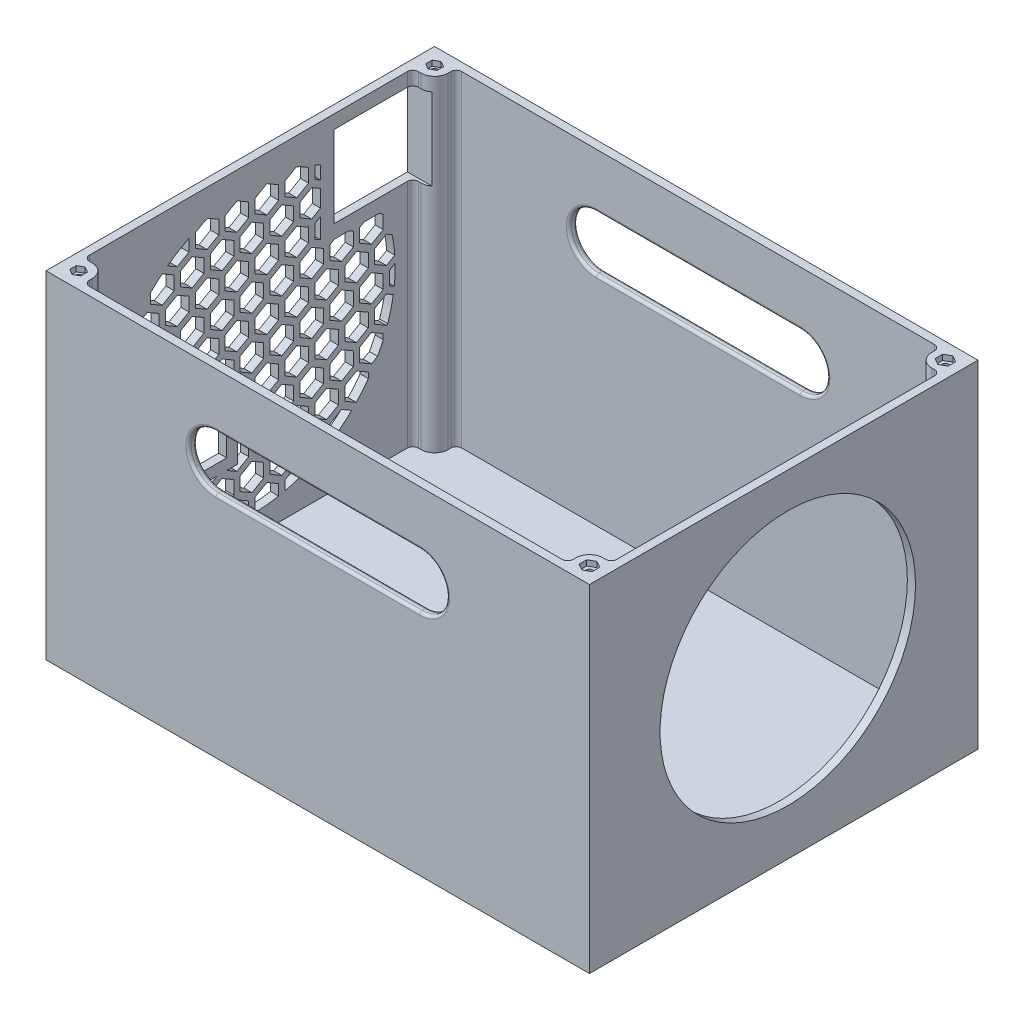
from build123d import *

# Parameters (mm, degrees)
SKETCH1_W            = 254
SKETCH1_H            = 152.4
BOSS_EXTRUDE1_DEPTH  = 3.81
SKETCH2_R            = 1.5875
BOSS_EXTRUDE2_DEPTH  = 152.4
SKETCH4_W            = 3.81
SKETCH4_H            = 152.4
BOSS_EXTRUDE3_DEPTH  = 177.8
SKETCH3_R            = 1.7145
CUT_EXTRUDE1_DEPTH   = 348.453525094
SKETCH5_W            = 3.81
SKETCH5_H            = 152.4
BOSS_EXTRUDE4_DEPTH  = 248.92
SKETCH6_R            = 1.5875
BOSS_EXTRUDE5_DEPTH  = 152.4
SKETCH8_R            = 59.69
CUT_EXTRUDE3_DEPTH   = 5.08
CUT_EXTRUDE4_DEPTH   = 5.08
SKETCH10_W           = 57.658
SKETCH10_H           = 36.720028342
SKETCH10_W_2         = 47.498
SKETCH10_H_2         = 27.178
BOSS_EXTRUDE6_DEPTH  = 3.81
SKETCH11_W           = 47.498
SKETCH11_H           = 26.973066783
CUT_EXTRUDE5_DEPTH   = 7.62
FILLET1_R            = 2.54
SKETCH12_W           = 47.498
SKETCH12_H           = 0.254
CUT_EXTRUDE6_DEPTH   = 7.62
SKETCH13_W           = 19.05
SKETCH13_H           = 12.7
BOSS_EXTRUDE9_DEPTH  = 3.81
SKETCH15_W           = 38.1
SKETCH15_H           = 38.1
CUT_EXTRUDE8_DEPTH   = 12.7
SKETCH16_W           = 50.8
SKETCH16_H           = 50.8
SKETCH16_W_2         = 38.1
SKETCH16_H_2         = 38.1
BOSS_EXTRUDE10_DEPTH = 3.81
CUT_EXTRUDE9_DEPTH   = 2.54
SKETCH19_W           = 181.61
SKETCH19_H           = 5.08
BOSS_EXTRUDE12_DEPTH = 254
CUT_EXTRUDE10_DEPTH  = 348.453525094
FILLET3_R            = 1.27


with BuildPart() as part:
    # Sketch1 → Boss-Extrude1 (new body)
    with BuildSketch(Plane.XY):
        with Locations((127, 76.2)):
            Rectangle(SKETCH1_W, SKETCH1_H)
    extrude(amount=BOSS_EXTRUDE1_DEPTH)

    # Sketch2 → Boss-Extrude2 (add, through all)
    # profile 1 of 2: a face of its own
    with BuildSketch(Plane(origin=(0, 152.4, 0), x_dir=(1, 0, 0), z_dir=(0, 1, 0))):
        with BuildLine():
            Line((13.97, -7.62), (13.97, 0))
            Line((13.97, 0), (2.54, 0))
            Line((2.54, 0), (0, 0))
            Line((0, 0), (0, -13.97))
            Line((0, -13.97), (2.54, -13.97))
            Line((2.54, -13.97), (7.62, -13.97))
            ThreePointArc((7.62, -13.97), (12.110128061, -12.110128061), (13.97, -7.62))
        make_face()
        with Locations(Location((7.62, -7.62, 0), (0, 0, 270))):
            Circle(SKETCH2_R, mode=Mode.SUBTRACT)
    # profile 2 of 2: a face of its own
    with BuildSketch(Plane(origin=(0, 152.4, 0), x_dir=(1, 0, 0), z_dir=(0, 1, 0))):
        with BuildLine():
            Line((254, -13.97), (251.46, -13.97))
            Line((251.46, -13.97), (246.38, -13.97))
            ThreePointArc((246.38, -13.97), (241.889871939, -12.110128061), (240.03, -7.62))
            Line((240.03, -7.62), (240.03, 0))
            Line((240.03, 0), (254, 0))
            Line((254, 0), (254, -13.97))
        make_face()
        with Locations(Location((246.38, -7.62, 0), (0, 0, 270))):
            Circle(SKETCH2_R, mode=Mode.SUBTRACT)
    extrude(amount=-BOSS_EXTRUDE2_DEPTH)

    # Sketch4 → Boss-Extrude3 (add)
    with BuildSketch(Plane.XY.offset(3.81)):
        with Locations((1.905, 76.2)):
            Rectangle(SKETCH4_W, SKETCH4_H)
        with Locations((252.095, 76.2)):
            Rectangle(SKETCH4_W, SKETCH4_H)
    extrude(amount=BOSS_EXTRUDE3_DEPTH)

    # Sketch3 → Cut-Extrude1 (cut, through all)
    with BuildSketch(Plane(origin=(0, 152.4, 0), x_dir=(1, 0, 0), z_dir=(0, 1, 0))):
        with Locations(Location((7.62, -7.62, 0), (0, 0, 270))):
            Circle(SKETCH3_R)
        with Locations(Location((246.38, -7.62, 0), (0, 0, 270))):
            Circle(SKETCH3_R)
    extrude(amount=-CUT_EXTRUDE1_DEPTH, mode=Mode.SUBTRACT)

    # Sketch5 → Boss-Extrude4 (add)
    with BuildSketch(Plane(origin=(3.81, 0, 0), x_dir=(0, 0, -1), z_dir=(1, 0, 0))):
        with Locations((-179.705, 76.2)):
            Rectangle(SKETCH5_W, SKETCH5_H)
    extrude(amount=BOSS_EXTRUDE4_DEPTH)

    # Sketch6 → Boss-Extrude5 (add, through all)
    # profile 1 of 2: a face of its own
    with BuildSketch(Plane(origin=(0, 152.4, 0), x_dir=(1, 0, 0), z_dir=(0, 1, 0))):
        with BuildLine():
            Line((7.62, -167.64), (0, -167.64))
            Line((0, -167.64), (0, -181.61))
            Line((0, -181.61), (13.97, -181.61))
            Line((13.97, -181.61), (13.97, -173.99))
            ThreePointArc((13.97, -173.99), (12.110128061, -169.499871939), (7.62, -167.64))
        make_face()
        with Locations(Location((7.62, -173.99, 0), (0, 0, 270))):
            Circle(SKETCH6_R, mode=Mode.SUBTRACT)
    # profile 2 of 2: a face of its own
    with BuildSketch(Plane(origin=(0, 152.4, 0), x_dir=(1, 0, 0), z_dir=(0, 1, 0))):
        with BuildLine():
            Line((240.03, -181.61), (240.03, -173.99))
            ThreePointArc((240.03, -173.99), (241.889871939, -169.499871939), (246.38, -167.64))
            Line((246.38, -167.64), (254, -167.64))
            Line((254, -167.64), (254, -181.61))
            Line((254, -181.61), (240.03, -181.61))
        make_face()
        with Locations(Location((246.38, -173.99, 0), (0, 0, 270))):
            Circle(SKETCH6_R, mode=Mode.SUBTRACT)
    extrude(amount=-BOSS_EXTRUDE5_DEPTH)

    # Sketch8 → Cut-Extrude3 (cut)
    with BuildSketch(Plane(origin=(254, 0, 0), x_dir=(0, 0, -1), z_dir=(1, 0, 0))):
        with Locations((-88.9, 76.2)):
            Circle(SKETCH8_R)
    extrude(amount=-CUT_EXTRUDE3_DEPTH, mode=Mode.SUBTRACT)

    # Sketch9 → Cut-Extrude4 (cut)
    with BuildSketch(Plane.ZY):
        Polygon((55.739425868, 124.586865773), (55.739425868, 118.236865773), (61.238687182, 115.061865773), (66.737948496, 118.236865773), (66.737948496, 124.586865773), (61.238687182, 127.761865773), align=None)
        with BuildLine():
            Line((49.436181633, 129.941628789), (54.253687182, 127.160240664))
            Line((54.253687182, 127.160240664), (59.752948496, 130.335240664))
            Line((59.752948496, 130.335240664), (59.752948496, 136.166699206))
            ThreePointArc((59.752948496, 136.166699206), (54.453654163, 133.287694677), (49.436181633, 129.941628789))
        make_face()
        with BuildLine():
            ThreePointArc((68.525810536, 139.685809664), (67.809311572, 139.451391183), (67.095508855, 139.208886603))
            Line((67.095508855, 139.208886603), (62.724425868, 136.685240664))
            Line((62.724425868, 136.685240664), (62.724425868, 130.335240664))
            Line((62.724425868, 130.335240664), (68.223687182, 127.160240664))
            Line((68.223687182, 127.160240664), (73.722948496, 130.335240664))
            Line((73.722948496, 130.335240664), (73.722948496, 136.685240664))
            Line((73.722948496, 136.685240664), (68.525810536, 139.685809664))
        make_face()
        Polygon((76.694425868, 136.685240664), (76.694425868, 130.335240664), (82.193687182, 127.160240664), (87.692948496, 130.335240664), (87.692948496, 136.685240664), (82.193687182, 139.860240664), align=None)
        Polygon((90.664425868, 136.685240664), (90.664425868, 130.335240664), (96.163687182, 127.160240664), (101.662948496, 130.335240664), (101.662948496, 136.685240664), (96.163687182, 139.860240664), align=None)
        with BuildLine():
            ThreePointArc((112.180132907, 138.678724674), (110.91017808, 139.137331417), (109.631196964, 139.570127801))
            Line((109.631196964, 139.570127801), (104.634425868, 136.685240664))
            Line((104.634425868, 136.685240664), (104.634425868, 130.335240664))
            Line((104.634425868, 130.335240664), (110.133687182, 127.160240664))
            Line((110.133687182, 127.160240664), (115.632948496, 130.335240664))
            Line((115.632948496, 130.335240664), (115.632948496, 136.685240664))
            Line((115.632948496, 136.685240664), (112.180132907, 138.678724674))
        make_face()
        with BuildLine():
            ThreePointArc((128.608497845, 129.761094312), (123.741602114, 133.047325242), (118.604425868, 135.892568288))
            Line((118.604425868, 135.892568288), (118.604425868, 130.335240664))
            Line((118.604425868, 130.335240664), (124.103687182, 127.160240664))
            Line((124.103687182, 127.160240664), (128.608497845, 129.761094312))
        make_face()
        with BuildLine():
            ThreePointArc((136.587948496, 122.798446253), (134.041922324, 125.268956316), (131.36809631, 127.600548838))
            Line((131.36809631, 127.600548838), (131.088687182, 127.761865773))
            Line((131.088687182, 127.761865773), (125.589425868, 124.586865773))
            Line((125.589425868, 124.586865773), (125.589425868, 118.236865773))
            Line((125.589425868, 118.236865773), (131.088687182, 115.061865773))
            Line((131.088687182, 115.061865773), (136.587948496, 118.236865773))
            Line((136.587948496, 118.236865773), (136.587948496, 122.798446253))
        make_face()
        Polygon((111.619425868, 124.586865773), (111.619425868, 118.236865773), (117.118687182, 115.061865773), (122.617948496, 118.236865773), (122.617948496, 124.586865773), (117.118687182, 127.761865773), align=None)
        Polygon((97.649425868, 124.586865773), (97.649425868, 118.236865773), (103.148687182, 115.061865773), (108.647948496, 118.236865773), (108.647948496, 124.586865773), (103.148687182, 127.761865773), align=None)
        Polygon((83.679425868, 124.586865773), (83.679425868, 118.236865773), (89.178687182, 115.061865773), (94.677948496, 118.236865773), (94.677948496, 124.586865773), (89.178687182, 127.761865773), align=None)
        Polygon((69.709425868, 124.586865773), (69.709425868, 118.236865773), (75.208687182, 115.061865773), (80.707948496, 118.236865773), (80.707948496, 124.586865773), (75.208687182, 127.761865773), align=None)
        with BuildLine():
            Line((47.268687182, 127.761865773), (45.23494911, 126.587686549))
            ThreePointArc((45.23494911, 126.587686549), (43.473548818, 125.005667273), (41.769425868, 123.362109866))
            Line((41.769425868, 123.362109866), (41.769425868, 118.236865773))
            Line((41.769425868, 118.236865773), (47.268687182, 115.061865773))
            Line((47.268687182, 115.061865773), (52.767948496, 118.236865773))
            Line((52.767948496, 118.236865773), (52.767948496, 124.586865773))
            Line((52.767948496, 124.586865773), (47.268687182, 127.761865773))
        make_face()
        Polygon((34.784425868, 112.488490882), (34.784425868, 106.138490882), (40.283687182, 102.963490882), (45.782948496, 106.138490882), (45.782948496, 112.488490882), (40.283687182, 115.663490882), align=None)
        with BuildLine():
            Line((31.812948496, 106.138490882), (31.812948496, 110.647411741))
            ThreePointArc((31.812948496, 110.647411741), (29.999317758, 107.445243742), (28.365124652, 104.147888857))
            Line((28.365124652, 104.147888857), (31.812948496, 106.138490882))
        make_face()
        Polygon((48.754425868, 112.488490882), (48.754425868, 106.138490882), (54.253687182, 102.963490882), (59.752948496, 106.138490882), (59.752948496, 112.488490882), (54.253687182, 115.663490882), align=None)
        Polygon((62.724425868, 112.488490882), (62.724425868, 106.138490882), (68.223687182, 102.963490882), (73.722948496, 106.138490882), (73.722948496, 112.488490882), (68.223687182, 115.663490882), align=None)
        Polygon((76.694425868, 112.488490882), (76.694425868, 106.138490882), (82.193687182, 102.963490882), (87.692948496, 106.138490882), (87.692948496, 112.488490882), (82.193687182, 115.663490882), align=None)
        Polygon((90.664425868, 112.488490882), (90.664425868, 106.138490882), (96.163687182, 102.963490882), (101.662948496, 106.138490882), (101.662948496, 112.488490882), (96.163687182, 115.663490882), align=None)
        Polygon((104.634425868, 112.488490882), (104.634425868, 106.138490882), (110.133687182, 102.963490882), (115.632948496, 106.138490882), (115.632948496, 112.488490882), (110.133687182, 115.663490882), align=None)
        Polygon((118.604425868, 112.488490882), (118.604425868, 106.138490882), (124.103687182, 102.963490882), (129.602948496, 106.138490882), (129.602948496, 112.488490882), (124.103687182, 115.663490882), align=None)
        Polygon((132.574425868, 112.488490882), (132.574425868, 106.138490882), (138.073687182, 102.963490882), (143.572948496, 106.138490882), (143.572948496, 112.488490882), (138.073687182, 115.663490882), align=None)
        with BuildLine():
            ThreePointArc((149.229654767, 104.588173255), (147.942525947, 107.176374139), (146.544425868, 109.706354492))
            Line((146.544425868, 109.706354492), (146.544425868, 106.138490882))
            Line((146.544425868, 106.138490882), (149.229654767, 104.588173255))
        make_face()
        Polygon((139.559425868, 100.390115991), (139.559425868, 94.040115991), (145.058687182, 90.865115991), (150.557948496, 94.040115991), (150.557948496, 100.390115991), (145.058687182, 103.565115991), align=None)
        Polygon((125.589425868, 100.390115991), (125.589425868, 94.040115991), (131.088687182, 90.865115991), (136.587948496, 94.040115991), (136.587948496, 100.390115991), (131.088687182, 103.565115991), align=None)
        Polygon((97.649425868, 100.390115991), (97.649425868, 94.040115991), (103.148687182, 90.865115991), (108.647948496, 94.040115991), (108.647948496, 100.390115991), (103.148687182, 103.565115991), align=None)
        Polygon((83.679425868, 100.390115991), (83.679425868, 94.040115991), (89.178687182, 90.865115991), (94.677948496, 94.040115991), (94.677948496, 100.390115991), (89.178687182, 103.565115991), align=None)
        Polygon((69.709425868, 100.390115991), (69.709425868, 94.040115991), (75.208687182, 90.865115991), (80.707948496, 94.040115991), (80.707948496, 100.390115991), (75.208687182, 103.565115991), align=None)
        Polygon((55.739425868, 100.390115991), (55.739425868, 94.040115991), (61.238687182, 90.865115991), (66.737948496, 94.040115991), (66.737948496, 100.390115991), (61.238687182, 103.565115991), align=None)
        Polygon((41.769425868, 100.390115991), (41.769425868, 94.040115991), (47.268687182, 90.865115991), (52.767948496, 94.040115991), (52.767948496, 100.390115991), (47.268687182, 103.565115991), align=None)
        Polygon((27.799425868, 100.390115991), (27.799425868, 94.040115991), (33.298687182, 90.865115991), (38.797948496, 94.040115991), (38.797948496, 100.390115991), (33.298687182, 103.565115991), align=None)
        Polygon((111.619425868, 100.390115991), (111.619425868, 94.040115991), (117.118687182, 90.865115991), (122.617948496, 94.040115991), (122.617948496, 100.390115991), (117.118687182, 103.565115991), align=None)
        with BuildLine():
            ThreePointArc((155.421811562, 80.71710212), (154.918659229, 85.532323326), (154.067418681, 90.298339175))
            Line((154.067418681, 90.298339175), (152.043687182, 91.4667411))
            Line((152.043687182, 91.4667411), (146.544425868, 88.2917411))
            Line((146.544425868, 88.2917411), (146.544425868, 81.9417411))
            Line((146.544425868, 81.9417411), (152.043687182, 78.7667411))
            Line((152.043687182, 78.7667411), (155.421811562, 80.71710212))
        make_face()
        Polygon((132.574425868, 88.2917411), (132.574425868, 81.9417411), (138.073687182, 78.7667411), (143.572948496, 81.9417411), (143.572948496, 88.2917411), (138.073687182, 91.4667411), align=None)
        Polygon((118.604425868, 88.2917411), (118.604425868, 81.9417411), (124.103687182, 78.7667411), (129.602948496, 81.9417411), (129.602948496, 88.2917411), (124.103687182, 91.4667411), align=None)
        Polygon((104.634425868, 88.2917411), (104.634425868, 81.9417411), (110.133687182, 78.7667411), (115.632948496, 81.9417411), (115.632948496, 88.2917411), (110.133687182, 91.4667411), align=None)
        Polygon((90.664425868, 88.2917411), (90.664425868, 81.9417411), (96.163687182, 78.7667411), (101.662948496, 81.9417411), (101.662948496, 88.2917411), (96.163687182, 91.4667411), align=None)
        Polygon((76.694425868, 88.2917411), (76.694425868, 81.9417411), (82.193687182, 78.7667411), (87.692948496, 81.9417411), (87.692948496, 88.2917411), (82.193687182, 91.4667411), align=None)
        Polygon((62.724425868, 88.2917411), (62.724425868, 81.9417411), (68.223687182, 78.7667411), (73.722948496, 81.9417411), (73.722948496, 88.2917411), (68.223687182, 91.4667411), align=None)
        Polygon((48.754425868, 88.2917411), (48.754425868, 81.9417411), (54.253687182, 78.7667411), (59.752948496, 81.9417411), (59.752948496, 88.2917411), (54.253687182, 91.4667411), align=None)
        Polygon((34.784425868, 88.2917411), (34.784425868, 81.9417411), (40.283687182, 78.7667411), (45.782948496, 81.9417411), (45.782948496, 88.2917411), (40.283687182, 91.4667411), align=None)
        with BuildLine():
            Line((26.313687182, 91.4667411), (23.654261002, 89.931320679))
            ThreePointArc((23.654261002, 89.931320679), (22.876781436, 85.500012662), (22.39991079, 81.026360954))
            Line((22.39991079, 81.026360954), (26.313687182, 78.7667411))
            Line((26.313687182, 78.7667411), (31.812948496, 81.9417411))
            Line((31.812948496, 81.9417411), (31.812948496, 88.2917411))
            Line((31.812948496, 88.2917411), (26.313687182, 91.4667411))
        make_face()
        Polygon((27.799425868, 76.193366209), (27.799425868, 69.843366209), (33.298687182, 66.668366209), (38.797948496, 69.843366209), (38.797948496, 76.193366209), (33.298687182, 79.368366209), align=None)
        with BuildLine():
            Line((24.827948496, 76.193366209), (22.24157505, 77.686609615))
            ThreePointArc((22.24157505, 77.686609615), (22.295616994, 73.132136019), (22.660482749, 68.591979276))
            Line((22.660482749, 68.591979276), (24.827948496, 69.843366209))
            Line((24.827948496, 69.843366209), (24.827948496, 76.193366209))
        make_face()
        Polygon((41.769425868, 76.193366209), (41.769425868, 69.843366209), (47.268687182, 66.668366209), (52.767948496, 69.843366209), (52.767948496, 76.193366209), (47.268687182, 79.368366209), align=None)
        Polygon((55.739425868, 76.193366209), (55.739425868, 69.843366209), (61.238687182, 66.668366209), (66.737948496, 69.843366209), (66.737948496, 76.193366209), (61.238687182, 79.368366209), align=None)
        Polygon((69.709425868, 76.193366209), (69.709425868, 69.843366209), (75.208687182, 66.668366209), (80.707948496, 69.843366209), (80.707948496, 76.193366209), (75.208687182, 79.368366209), align=None)
        Polygon((83.679425868, 76.193366209), (83.679425868, 69.843366209), (89.178687182, 66.668366209), (94.677948496, 69.843366209), (94.677948496, 76.193366209), (89.178687182, 79.368366209), align=None)
        Polygon((97.649425868, 76.193366209), (97.649425868, 69.843366209), (103.148687182, 66.668366209), (108.647948496, 69.843366209), (108.647948496, 76.193366209), (103.148687182, 79.368366209), align=None)
        Polygon((111.619425868, 76.193366209), (111.619425868, 69.843366209), (117.118687182, 66.668366209), (122.617948496, 69.843366209), (122.617948496, 76.193366209), (117.118687182, 79.368366209), align=None)
        Polygon((125.589425868, 76.193366209), (125.589425868, 69.843366209), (131.088687182, 66.668366209), (136.587948496, 69.843366209), (136.587948496, 76.193366209), (131.088687182, 79.368366209), align=None)
        Polygon((139.559425868, 76.193366209), (139.559425868, 69.843366209), (145.058687182, 66.668366209), (150.557948496, 69.843366209), (150.557948496, 76.193366209), (145.058687182, 79.368366209), align=None)
        with BuildLine():
            ThreePointArc((155.575, 76.2), (155.572440107, 76.784256071), (155.564760625, 77.368467279))
            Line((155.564760625, 77.368467279), (153.529425868, 76.193366209))
            Line((153.529425868, 76.193366209), (153.529425868, 69.843366209))
            Line((153.529425868, 69.843366209), (155.173524956, 68.894145159))
            ThreePointArc((155.173524956, 68.894145159), (155.47455558, 72.541561222), (155.575, 76.2))
        make_face()
        with BuildLine():
            ThreePointArc((151.981332006, 54.605992096), (153.601696077, 60.098877375), (154.744719284, 65.710549708))
            Line((154.744719284, 65.710549708), (152.043687182, 67.269991318))
            Line((152.043687182, 67.269991318), (146.544425868, 64.094991318))
            Line((146.544425868, 64.094991318), (146.544425868, 57.744991318))
            Line((146.544425868, 57.744991318), (151.981332006, 54.605992096))
        make_face()
        Polygon((132.574425868, 64.094991318), (132.574425868, 57.744991318), (138.073687182, 54.569991318), (143.572948496, 57.744991318), (143.572948496, 64.094991318), (138.073687182, 67.269991318), align=None)
        Polygon((118.604425868, 64.094991318), (118.604425868, 57.744991318), (124.103687182, 54.569991318), (129.602948496, 57.744991318), (129.602948496, 64.094991318), (124.103687182, 67.269991318), align=None)
        Polygon((104.634425868, 64.094991318), (104.634425868, 57.744991318), (110.133687182, 54.569991318), (115.632948496, 57.744991318), (115.632948496, 64.094991318), (110.133687182, 67.269991318), align=None)
        with BuildLine():
            Line((47.268687182, 30.974866646), (42.562957924, 28.258012592))
            ThreePointArc((42.562957924, 28.258012592), (46.981052097, 24.350627471), (51.727169032, 20.848972342))
            Line((51.727169032, 20.848972342), (52.767948496, 21.449866646))
            Line((52.767948496, 21.449866646), (52.767948496, 27.799866646))
            Line((52.767948496, 27.799866646), (47.268687182, 30.974866646))
        make_face()
        with BuildLine():
            ThreePointArc((126.329795799, 21.022413867), (131.051708912, 24.539676145), (135.444912051, 28.459799045))
            Line((135.444912051, 28.459799045), (131.088687182, 30.974866646))
            Line((131.088687182, 30.974866646), (125.589425868, 27.799866646))
            Line((125.589425868, 27.799866646), (125.589425868, 21.449866646))
            Line((125.589425868, 21.449866646), (126.329795799, 21.022413867))
        make_face()
        with BuildLine():
            ThreePointArc((104.634425868, 11.408152769), (110.214591648, 13.023708498), (115.632948496, 15.118864699))
            Line((115.632948496, 15.118864699), (115.632948496, 15.701491755))
            Line((115.632948496, 15.701491755), (110.133687182, 18.876491755))
            Line((110.133687182, 18.876491755), (104.634425868, 15.701491755))
            Line((104.634425868, 15.701491755), (104.634425868, 11.408152769))
        make_face()
        with BuildLine():
            Line((90.664425868, 15.701491755), (90.664425868, 9.54835016))
            ThreePointArc((90.664425868, 9.54835016), (96.188822294, 9.924599627), (101.662948496, 10.75794341))
            Line((101.662948496, 10.75794341), (101.662948496, 15.701491755))
            Line((101.662948496, 15.701491755), (96.163687182, 18.876491755))
            Line((96.163687182, 18.876491755), (90.664425868, 15.701491755))
        make_face()
        with BuildLine():
            Line((76.694425868, 15.701491755), (76.694425868, 10.651700364))
            ThreePointArc((76.694425868, 10.651700364), (82.170522364, 9.865470864), (87.692948496, 9.53592683))
            Line((87.692948496, 9.53592683), (87.692948496, 15.701491755))
            Line((87.692948496, 15.701491755), (82.193687182, 18.876491755))
            Line((82.193687182, 18.876491755), (76.694425868, 15.701491755))
        make_face()
        with BuildLine():
            Line((62.724425868, 15.701491755), (62.724425868, 14.877940805))
            ThreePointArc((62.724425868, 14.877940805), (68.145371304, 12.837542561), (73.722948496, 11.275330323))
            Line((73.722948496, 11.275330323), (73.722948496, 15.701491755))
            Line((73.722948496, 15.701491755), (68.223687182, 18.876491755))
            Line((68.223687182, 18.876491755), (62.724425868, 15.701491755))
        make_face()
        Polygon((111.619425868, 27.799866646), (111.619425868, 21.449866646), (117.118687182, 18.274866646), (122.617948496, 21.449866646), (122.617948496, 27.799866646), (117.118687182, 30.974866646), align=None)
        Polygon((97.649425868, 27.799866646), (97.649425868, 21.449866646), (103.148687182, 18.274866646), (108.647948496, 21.449866646), (108.647948496, 27.799866646), (103.148687182, 30.974866646), align=None)
        Polygon((83.679425868, 27.799866646), (83.679425868, 21.449866646), (89.178687182, 18.274866646), (94.677948496, 21.449866646), (94.677948496, 27.799866646), (89.178687182, 30.974866646), align=None)
        Polygon((69.709425868, 27.799866646), (69.709425868, 21.449866646), (75.208687182, 18.274866646), (80.707948496, 21.449866646), (80.707948496, 27.799866646), (75.208687182, 30.974866646), align=None)
        Polygon((90.664425868, 64.094991318), (90.664425868, 57.744991318), (96.163687182, 54.569991318), (101.662948496, 57.744991318), (101.662948496, 64.094991318), (96.163687182, 67.269991318), align=None)
        Polygon((76.694425868, 64.094991318), (76.694425868, 57.744991318), (82.193687182, 54.569991318), (87.692948496, 57.744991318), (87.692948496, 64.094991318), (82.193687182, 67.269991318), align=None)
        Polygon((62.724425868, 64.094991318), (62.724425868, 57.744991318), (68.223687182, 54.569991318), (73.722948496, 57.744991318), (73.722948496, 64.094991318), (68.223687182, 67.269991318), align=None)
        Polygon((48.754425868, 64.094991318), (48.754425868, 57.744991318), (54.253687182, 54.569991318), (59.752948496, 57.744991318), (59.752948496, 64.094991318), (54.253687182, 67.269991318), align=None)
        Polygon((69.709425868, 51.996616427), (69.709425868, 45.646616427), (75.208687182, 42.471616427), (80.707948496, 45.646616427), (80.707948496, 51.996616427), (75.208687182, 55.171616427), align=None)
        with BuildLine():
            Line((26.313687182, 67.269991318), (23.102845641, 65.41621109))
            ThreePointArc((23.102845641, 65.41621109), (24.1946852, 60.113426043), (25.713157388, 54.916707357))
            Line((25.713157388, 54.916707357), (26.313687182, 54.569991318))
            Line((26.313687182, 54.569991318), (31.812948496, 57.744991318))
            Line((31.812948496, 57.744991318), (31.812948496, 64.094991318))
            Line((31.812948496, 64.094991318), (26.313687182, 67.269991318))
        make_face()
        with BuildLine():
            Line((27.799425868, 51.996616427), (27.799425868, 49.511510613))
            ThreePointArc((27.799425868, 49.511510613), (29.065154706, 46.783220543), (30.452633059, 44.114786542))
            Line((30.452633059, 44.114786542), (33.298687182, 42.471616427))
            Line((33.298687182, 42.471616427), (38.797948496, 45.646616427))
            Line((38.797948496, 45.646616427), (38.797948496, 51.996616427))
            Line((38.797948496, 51.996616427), (33.298687182, 55.171616427))
            Line((33.298687182, 55.171616427), (27.799425868, 51.996616427))
        make_face()
        Polygon((41.769425868, 51.996616427), (41.769425868, 45.646616427), (47.268687182, 42.471616427), (52.767948496, 45.646616427), (52.767948496, 51.996616427), (47.268687182, 55.171616427), align=None)
        with BuildLine():
            Line((34.784425868, 39.898241537), (34.784425868, 37.250542219))
            ThreePointArc((34.784425868, 37.250542219), (37.481545441, 33.75358489), (40.404243695, 30.442844872))
            Line((40.404243695, 30.442844872), (45.782948496, 33.548241537))
            Line((45.782948496, 33.548241537), (45.782948496, 39.898241537))
            Line((45.782948496, 39.898241537), (40.283687182, 43.073241537))
            Line((40.283687182, 43.073241537), (34.784425868, 39.898241537))
        make_face()
        Polygon((48.754425868, 39.898241537), (48.754425868, 33.548241537), (54.253687182, 30.373241537), (59.752948496, 33.548241537), (59.752948496, 39.898241537), (54.253687182, 43.073241537), align=None)
        Polygon((55.739425868, 27.799866646), (55.739425868, 21.449866646), (61.238687182, 18.274866646), (66.737948496, 21.449866646), (66.737948496, 27.799866646), (61.238687182, 30.974866646), align=None)
        with BuildLine():
            ThreePointArc((147.08507671, 43.641552967), (148.929083057, 47.181646974), (150.557948496, 50.825741149))
            Line((150.557948496, 50.825741149), (150.557948496, 51.996616427))
            Line((150.557948496, 51.996616427), (145.058687182, 55.171616427))
            Line((145.058687182, 55.171616427), (139.559425868, 51.996616427))
            Line((139.559425868, 51.996616427), (139.559425868, 45.646616427))
            Line((139.559425868, 45.646616427), (145.058687182, 42.471616427))
            Line((145.058687182, 42.471616427), (147.08507671, 43.641552967))
        make_face()
        with BuildLine():
            ThreePointArc((137.591764472, 30.651479743), (140.714109825, 34.237473289), (143.572948496, 38.036872145))
            Line((143.572948496, 38.036872145), (143.572948496, 39.898241537))
            Line((143.572948496, 39.898241537), (138.073687182, 43.073241537))
            Line((138.073687182, 43.073241537), (132.574425868, 39.898241537))
            Line((132.574425868, 39.898241537), (132.574425868, 33.548241537))
            Line((132.574425868, 33.548241537), (137.591764472, 30.651479743))
        make_face()
        Polygon((125.589425868, 51.996616427), (125.589425868, 45.646616427), (131.088687182, 42.471616427), (136.587948496, 45.646616427), (136.587948496, 51.996616427), (131.088687182, 55.171616427), align=None)
        Polygon((118.604425868, 39.898241537), (118.604425868, 33.548241537), (124.103687182, 30.373241537), (129.602948496, 33.548241537), (129.602948496, 39.898241537), (124.103687182, 43.073241537), align=None)
        Polygon((111.619425868, 51.996616427), (111.619425868, 45.646616427), (117.118687182, 42.471616427), (122.617948496, 45.646616427), (122.617948496, 51.996616427), (117.118687182, 55.171616427), align=None)
        Polygon((104.634425868, 39.898241537), (104.634425868, 33.548241537), (110.133687182, 30.373241537), (115.632948496, 33.548241537), (115.632948496, 39.898241537), (110.133687182, 43.073241537), align=None)
        Polygon((97.649425868, 51.996616427), (97.649425868, 45.646616427), (103.148687182, 42.471616427), (108.647948496, 45.646616427), (108.647948496, 51.996616427), (103.148687182, 55.171616427), align=None)
        Polygon((90.664425868, 39.898241537), (90.664425868, 33.548241537), (96.163687182, 30.373241537), (101.662948496, 33.548241537), (101.662948496, 39.898241537), (96.163687182, 43.073241537), align=None)
        Polygon((83.679425868, 51.996616427), (83.679425868, 45.646616427), (89.178687182, 42.471616427), (94.677948496, 45.646616427), (94.677948496, 51.996616427), (89.178687182, 55.171616427), align=None)
        Polygon((34.784425868, 64.094991318), (34.784425868, 57.744991318), (40.283687182, 54.569991318), (45.782948496, 57.744991318), (45.782948496, 64.094991318), (40.283687182, 67.269991318), align=None)
        Polygon((62.724425868, 39.898241537), (62.724425868, 33.548241537), (68.223687182, 30.373241537), (73.722948496, 33.548241537), (73.722948496, 39.898241537), (68.223687182, 43.073241537), align=None)
        Polygon((76.694425868, 39.898241537), (76.694425868, 33.548241537), (82.193687182, 30.373241537), (87.692948496, 33.548241537), (87.692948496, 39.898241537), (82.193687182, 43.073241537), align=None)
        Polygon((55.739425868, 51.996616427), (55.739425868, 45.646616427), (61.238687182, 42.471616427), (66.737948496, 45.646616427), (66.737948496, 51.996616427), (61.238687182, 55.171616427), align=None)
    extrude(amount=-CUT_EXTRUDE4_DEPTH, mode=Mode.SUBTRACT)

    # Sketch10 → Boss-Extrude6 (add)
    with BuildSketch(Plane.ZY):
        with Locations((124.700425868, 51.483352038)):
            Rectangle(SKETCH10_W, SKETCH10_H)
        with Locations((124.700425868, 51.810776798)):
            Rectangle(SKETCH10_W_2, SKETCH10_H_2, mode=Mode.SUBTRACT)
    extrude(amount=-BOSS_EXTRUDE6_DEPTH)

    # Sketch11 → Cut-Extrude5 (cut)
    with BuildSketch(Plane.ZY):
        with Locations((124.700425868, 51.708310189)):
            Rectangle(SKETCH11_W, SKETCH11_H)
    extrude(amount=-CUT_EXTRUDE5_DEPTH, mode=Mode.SUBTRACT)

    # Fillet1
    fillet1_edges = [part.edges().sort_by_distance(p)[0] for p in [
        (240.03, 76.2, 177.8),
        (250.19, 76.2, 167.64),
        (13.97, 76.2, 177.8),
        (3.81, 76.2, 167.64),
        (13.97, 76.2, 3.81),
        (240.03, 76.2, 3.81),
        (3.81, 76.2, 13.97),
        (250.19, 76.2, 13.97),
    ]]
    fillet(fillet1_edges, radius=FILLET1_R)

    # Sketch12 → Cut-Extrude6 (cut)
    with BuildSketch(Plane.ZY):
        with Locations((124.700425868, 65.321843581)):
            Rectangle(SKETCH12_W, SKETCH12_H)
    extrude(amount=-CUT_EXTRUDE6_DEPTH, mode=Mode.SUBTRACT)

    # Sketch13 → Boss-Extrude9 (add)
    with BuildSketch(Plane.ZY):
        with Locations((124.446425868, 76.193366209)):
            Rectangle(SKETCH13_W, SKETCH13_H)
        with Locations((124.446425868, 26.773337867)):
            Rectangle(SKETCH13_W, SKETCH13_H)
    extrude(amount=-BOSS_EXTRUDE9_DEPTH)

    # Sketch15 → Cut-Extrude8 (cut)
    with BuildSketch(Plane.ZY):
        with Locations((31.75, 127)):
            Rectangle(SKETCH15_W, SKETCH15_H)
    extrude(amount=-CUT_EXTRUDE8_DEPTH, mode=Mode.SUBTRACT)

    # Sketch16 → Boss-Extrude10 (add)
    with BuildSketch(Plane.ZY):
        with Locations((31.75, 127)):
            Rectangle(SKETCH16_W, SKETCH16_H)
        with Locations((31.75, 127)):
            Rectangle(SKETCH16_W_2, SKETCH16_H_2, mode=Mode.SUBTRACT)
    extrude(amount=-BOSS_EXTRUDE10_DEPTH)

    # Sketch17 → Cut-Extrude9 (cut)
    with BuildSketch(Plane(origin=(0, 152.4, 0), x_dir=(1, 0, 0), z_dir=(0, 1, 0))):
        Polygon((246.38, -4.100472759), (243.332, -5.86023638), (243.332, -9.37976362), (246.38, -11.139527241), (249.428, -9.37976362), (249.428, -5.86023638), align=None)
        Polygon((10.259645431, -175.514), (10.259645431, -172.466), (7.62, -170.942), (4.980354569, -172.466), (4.980354569, -175.514), (7.62, -177.038), align=None)
        Polygon((10.259645431, -9.144), (10.259645431, -6.096), (7.62, -4.572), (4.980354569, -6.096), (4.980354569, -9.144), (7.62, -10.668), align=None)
        Polygon((246.38, -177.509527241), (249.428, -175.74976362), (249.428, -172.23023638), (246.38, -170.470472759), (243.332, -172.23023638), (243.332, -175.74976362), align=None)
    extrude(amount=-CUT_EXTRUDE9_DEPTH, mode=Mode.SUBTRACT)

    # Sketch19 → Boss-Extrude12 (add, through all)
    with BuildSketch(Plane(origin=(254, 0, 0), x_dir=(0, 0, -1), z_dir=(1, 0, 0))):
        with Locations((-90.805, -2.54)):
            Rectangle(SKETCH19_W, SKETCH19_H)
    extrude(amount=-BOSS_EXTRUDE12_DEPTH)

    # Sketch20 → Cut-Extrude10 (cut, through all)
    with BuildSketch(Plane.XY.offset(181.61)):
        with BuildLine():
            Line((79.375, 127), (174.625, 127))
            ThreePointArc((174.625, 127), (187.325, 114.3), (174.625, 101.6))
            Line((174.625, 101.6), (79.375, 101.6))
            ThreePointArc((79.375, 101.6), (66.675, 114.3), (79.375, 127))
        make_face()
    extrude(amount=-CUT_EXTRUDE10_DEPTH, mode=Mode.SUBTRACT)

    # Fillet3
    fillet3_edges = [part.edges().sort_by_distance(p)[0] for p in [
        (127, 101.6, 177.8),
        (187.325, 114.3, 177.8),
        (127, 127, 177.8),
        (66.675, 114.3, 177.8),
        (66.675, 114.3, 3.81),
        (66.675, 114.3, 0),
        (127, 127, 3.81),
        (127, 127, 0),
        (187.325, 114.3, 3.81),
        (187.325, 114.3, 0),
        (127, 101.6, 3.81),
        (127, 101.6, 0),
        (66.675, 114.3, 181.61),
        (127, 101.6, 181.61),
        (187.325, 114.3, 181.61),
        (127, 127, 181.61),
    ]]
    fillet(fillet3_edges, radius=FILLET3_R)


solid = part.part
